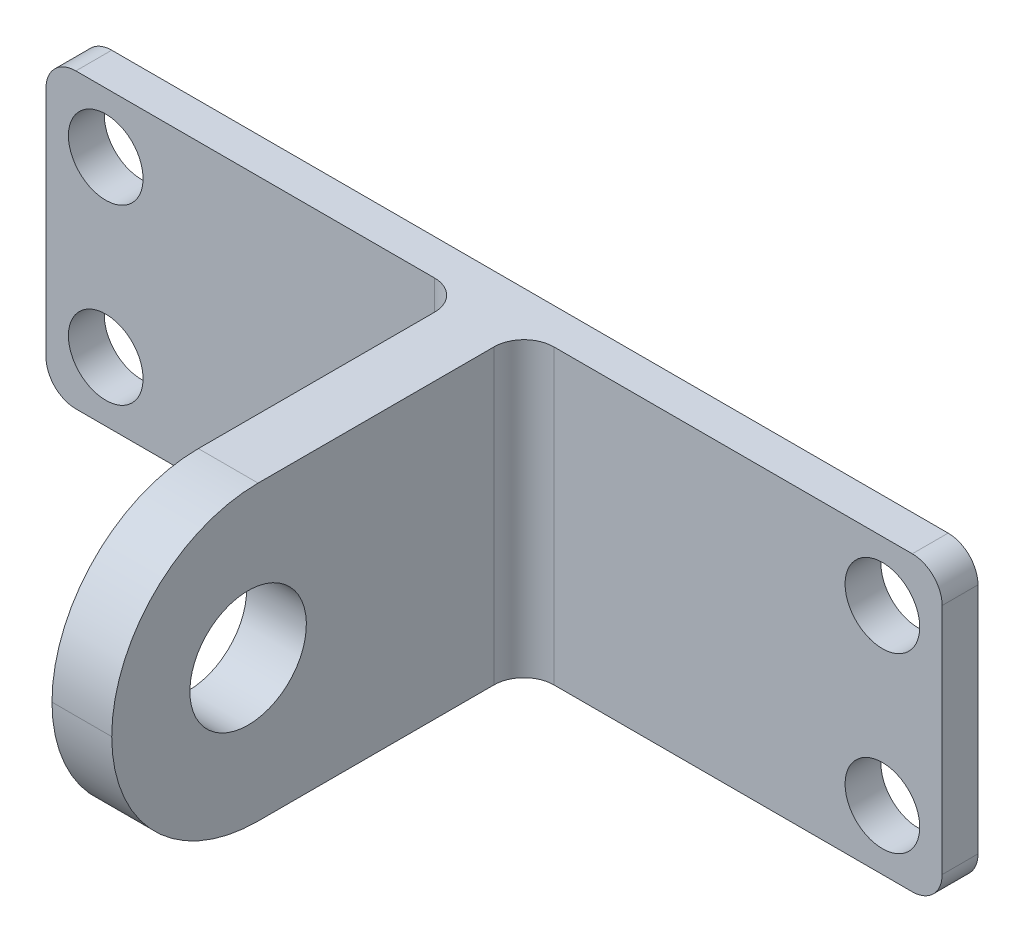
from build123d import *

# Parameters (mm, degrees)
SKETCH1_R             = 3.175
BOSS_EXTRUDE9_DEPTH   = 3.048
BOSS_EXTRUDE9_2_DEPTH = 3.048
SKETCH1_17_W          = 5.08
SKETCH1_17_H          = 24.892
BOSS_EXTRUDE10_DEPTH  = 38.1
FILLET3_R             = 2.54
FILLET4_R             = 2.54
FILLET6_R             = 12.446
SKETCH2_R             = 4.953
CUT_EXTRUDE1_DEPTH    = 38.1


with BuildPart() as part:
    # Sketch1 → Boss-Extrude9 (new body)
    with BuildSketch(Plane.XY):
        with BuildLine():
            Line((0, 2.809544612), (0, 27.701544612))
            Line((0, 27.701544612), (-33.02, 27.701544612))
            ThreePointArc((-33.02, 27.701544612), (-34.816051224, 26.957595836), (-35.56, 25.161544612))
            Line((-35.56, 25.161544612), (-35.56, 5.349544612))
            ThreePointArc((-35.56, 5.349544612), (-34.816051224, 3.553493388), (-33.02, 2.809544612))
            Line((-33.02, 2.809544612), (0, 2.809544612))
        make_face()
        with Locations(Location((-30.48, 7.889544612, 0), (0, 0, 180))):
            Circle(SKETCH1_R, mode=Mode.SUBTRACT)
        with Locations(Location((-30.48, 22.621544612, 0), (0, 0, 180))):
            Circle(SKETCH1_R, mode=Mode.SUBTRACT)
    extrude(amount=BOSS_EXTRUDE9_DEPTH)



with BuildPart() as body_2:
    # Sketch1 → Boss-Extrude9 2 (new body)
    with BuildSketch(Plane.XY):
        with BuildLine():
            Line((38.1, 27.701544612), (5.08, 27.701544612))
            Line((5.08, 27.701544612), (5.08, 2.809544612))
            Line((5.08, 2.809544612), (38.1, 2.809544612))
            ThreePointArc((38.1, 2.809544612), (39.896051224, 3.553493388), (40.64, 5.349544612))
            Line((40.64, 5.349544612), (40.64, 25.161544612))
            ThreePointArc((40.64, 25.161544612), (39.896051224, 26.957595836), (38.1, 27.701544612))
        make_face()
        with Locations(Location((35.56, 7.889544612, 0), (0, 0, 180))):
            Circle(SKETCH1_R, mode=Mode.SUBTRACT)
        with Locations(Location((35.56, 22.621544612, 0), (0, 0, 180))):
            Circle(SKETCH1_R, mode=Mode.SUBTRACT)
    extrude(amount=BOSS_EXTRUDE9_2_DEPTH)


with BuildPart() as part_1:
    add(part.part)

    add(body_2.part)  # Boss-Extrude10 merges body 2
    # Sketch1<17> → Boss-Extrude10 (add)
    with BuildSketch(Plane.XY):
        with Locations((2.54, 15.255544612)):
            Rectangle(SKETCH1_17_W, SKETCH1_17_H)
    extrude(amount=BOSS_EXTRUDE10_DEPTH)

    # Fillet3
    fillet3_edges = [part_1.edges().sort_by_distance(p)[0] for p in [
        (5.08, 15.255544612, 3.048),
    ]]
    fillet(fillet3_edges, radius=FILLET3_R)

    # Fillet4
    fillet4_edges = [part_1.edges().sort_by_distance(p)[0] for p in [
        (0, 15.255544612, 3.048),
    ]]
    fillet(fillet4_edges, radius=FILLET4_R)

    # Fillet6
    fillet6_edges = [part_1.edges().sort_by_distance(p)[0] for p in [
        (2.54, 2.809544612, 38.1),
        (2.54, 27.701544612, 38.1),
    ]]
    fillet(fillet6_edges, radius=FILLET6_R - 0.0001)  # a hair under: the kernel refuses the full size

    # Sketch2 → Cut-Extrude1 (cut)
    with BuildSketch(Plane.ZY):
        with Locations(Location((26.501688995, 15.255544612, 0), (0, 0, 270))):
            Circle(SKETCH2_R)
    extrude(amount=-CUT_EXTRUDE1_DEPTH, mode=Mode.SUBTRACT)


solid = part_1.part
